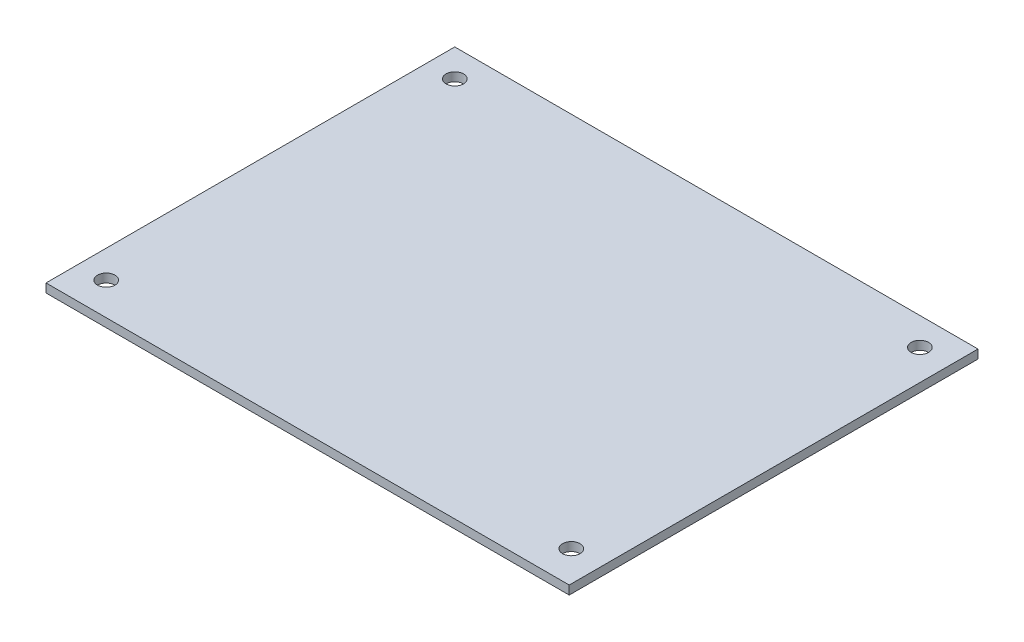
from build123d import *

# Parameters (mm, degrees)
SKETCH1_W           = 96
SKETCH1_H           = 75
SKETCH1_R           = 1.6
BOSS_EXTRUDE1_DEPTH = 1.6


with BuildPart() as part:
    # Sketch1 → Boss-Extrude1 (new body)
    with BuildSketch(Plane(origin=(0, 0, 0), x_dir=(1, 0, 0), z_dir=(0, 1, 0))):
        with Locations((48, 37.5)):
            Rectangle(SKETCH1_W, SKETCH1_H)
        with Locations((5.08, 69.92)):
            Circle(SKETCH1_R, mode=Mode.SUBTRACT)
        with Locations((90.412, 69.92)):
            Circle(SKETCH1_R, mode=Mode.SUBTRACT)
        with Locations((90.412, 5.969)):
            Circle(SKETCH1_R, mode=Mode.SUBTRACT)
        with Locations((5.08, 5.969)):
            Circle(SKETCH1_R, mode=Mode.SUBTRACT)
    extrude(amount=BOSS_EXTRUDE1_DEPTH)


solid = part.part
